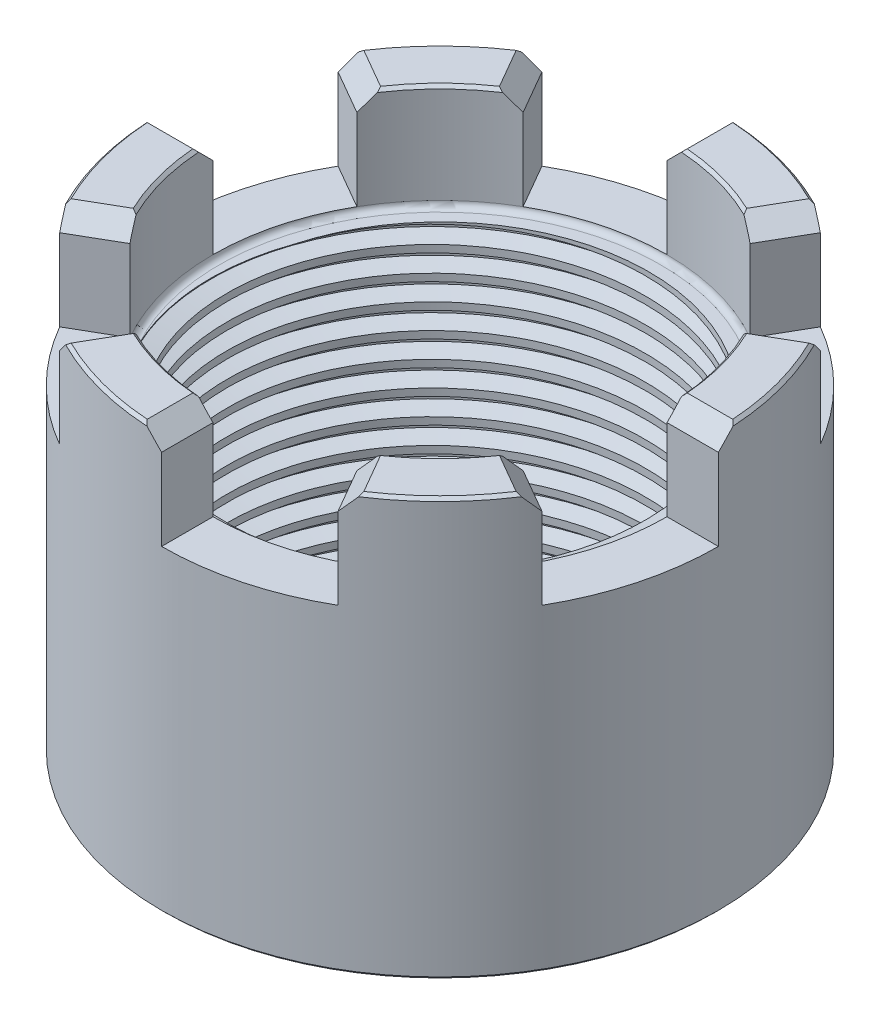
from build123d import *
from build123d.topology import SkipClean

# Parameters (mm, degrees)
SKETCH1_R           = 35.56
BOSS_EXTRUDE1_DEPTH = 40.64
SKETCH2_R           = 26.70175
CUT_EXTRUDE1_DEPTH  = 67.31
BOSS_EXTRUDE2_DEPTH = 12.7
CHAMFER1_SIZE       = 2.286
CHAMFER2_SIZE       = 2.286
CHAMFER3_SIZE       = 2.286
CHAMFER4_SIZE       = 2.286
CHAMFER5_SIZE       = 2.286
CHAMFER6_SIZE       = 2.286
CHAMFER7_SIZE       = 2.286
CHAMFER8_SIZE       = 2.286
CHAMFER9_SIZE       = 2.286
CHAMFER10_SIZE      = 2.286
CHAMFER11_SIZE      = 2.286
CHAMFER12_SIZE      = 2.286
CHAMFER13_SIZE      = 0.381
CHAMFER14_SIZE      = 0.381
CHAMFER15_SIZE      = 0.381
CHAMFER16_SIZE      = 0.381
CHAMFER17_SIZE      = 0.381
CHAMFER18_SIZE      = 0.381
CHAMFER20_SIZE      = 0.381
CHAMFER21_SIZE      = 0.381
CHAMFER22_SIZE      = 0.381
CHAMFER23_SIZE      = 0.381
CHAMFER24_SIZE      = 0.381
CHAMFER25_SIZE      = 0.381
CHAMFER26_SIZE      = 0.381
CUT_EXTRUDE2_START  = -0.762
SKETCH4_R           = 28.9941
CUT_EXTRUDE2_DEPTH  = 0.762
FILLET1_R           = 0.762
CHAMFER27_SIZE      = 2.55905
THREAD3_PITCH       = 3.175


with BuildPart() as part:
    # Sketch1 → Boss-Extrude1 (new body)
    with BuildSketch(Plane(origin=(0, 0, 0), x_dir=(1, 0, 0), z_dir=(0, 1, 0))):
        with Locations(Location((0, 0, 0), (0, 0, 270))):
            Circle(SKETCH1_R)
    extrude(amount=BOSS_EXTRUDE1_DEPTH)

    # Sketch2 → Cut-Extrude1 (cut)
    with BuildSketch(Plane(origin=(0, 40.64, 0), x_dir=(1, 0, 0), z_dir=(0, 1, 0))):
        with Locations(Location((0, 0, 0), (0, 0, 270))):
            Circle(SKETCH2_R)
    extrude(amount=-CUT_EXTRUDE1_DEPTH, mode=Mode.SUBTRACT)

    # Sketch3 → Boss-Extrude2 (add)
    with SkipClean():  # the faces are left unmerged after this step: merging them gives an invalid solid
        with BuildSketch(Plane(origin=(0, 40.64, 0), x_dir=(1, 0, 0), z_dir=(0, 1, 0))):
            with BuildLine():
                Line((-28.9941, 0), (-35.56, 0))
                ThreePointArc((-35.56, 0), (-34.348322383, -9.203605244), (-30.795863359, -17.78))
                Line((-30.795863359, -17.78), (-25.10962716, -14.49705))
                ThreePointArc((-25.10962716, -14.49705), (-28.00615, -7.504225276), (-28.9941, 0))
            make_face()
            with BuildLine():
                Line((-25.10962716, 14.49705), (-30.795863359, 17.78))
                ThreePointArc((-30.795863359, 17.78), (-25.144717139, 25.144717139), (-17.78, 30.795863359))
                Line((-17.78, 30.795863359), (-14.49705, 25.10962716))
                ThreePointArc((-14.49705, 25.10962716), (-20.501924724, 20.501924724), (-25.10962716, 14.49705))
            make_face()
            with BuildLine():
                Line((0, 28.9941), (0, 35.56))
                ThreePointArc((0, 35.56), (9.203605244, 34.348322383), (17.78, 30.795863359))
                Line((17.78, 30.795863359), (14.49705, 25.10962716))
                ThreePointArc((14.49705, 25.10962716), (7.504225276, 28.00615), (0, 28.9941))
            make_face()
            with BuildLine():
                Line((25.10962716, 14.49705), (30.795863359, 17.78))
                ThreePointArc((30.795863359, 17.78), (34.348322383, 9.203605244), (35.56, 0))
                Line((35.56, 0), (28.9941, 0))
                ThreePointArc((28.9941, 0), (28.00615, 7.504225276), (25.10962716, 14.49705))
            make_face()
            with BuildLine():
                Line((25.10962716, -14.49705), (30.795863359, -17.78))
                ThreePointArc((30.795863359, -17.78), (25.144717139, -25.144717139), (17.78, -30.795863359))
                Line((17.78, -30.795863359), (14.49705, -25.10962716))
                ThreePointArc((14.49705, -25.10962716), (20.501924724, -20.501924724), (25.10962716, -14.49705))
            make_face()
            with BuildLine():
                Line((0, -28.9941), (0, -35.56))
                ThreePointArc((0, -35.56), (-9.203605244, -34.348322383), (-17.78, -30.795863359))
                Line((-17.78, -30.795863359), (-14.49705, -25.10962716))
                ThreePointArc((-14.49705, -25.10962716), (-7.504225276, -28.00615), (0, -28.9941))
            make_face()
        extrude(amount=BOSS_EXTRUDE2_DEPTH)

    # Chamfer1
    chamfer1_edges = [part.edges().sort_by_distance(p)[0] for p in [
        (0, 53.34, 32.27705),
    ]]
    chamfer(chamfer1_edges, length=CHAMFER1_SIZE)

    # Chamfer2
    chamfer2_edges = [part.edges().sort_by_distance(p)[0] for p in [
        (-16.138525, 53.34, 27.952745259),
    ]]
    chamfer(chamfer2_edges, length=CHAMFER2_SIZE)

    # Chamfer3
    chamfer3_edges = [part.edges().sort_by_distance(p)[0] for p in [
        (-27.952745259, 53.34, 16.138525),
    ]]
    chamfer(chamfer3_edges, length=CHAMFER3_SIZE)

    # Chamfer4
    chamfer4_edges = [part.edges().sort_by_distance(p)[0] for p in [
        (16.138525, 53.34, 27.952745259),
    ]]
    chamfer(chamfer4_edges, length=CHAMFER4_SIZE)

    # Chamfer5
    chamfer5_edges = [part.edges().sort_by_distance(p)[0] for p in [
        (27.952745259, 53.34, 16.138525),
    ]]
    chamfer(chamfer5_edges, length=CHAMFER5_SIZE)

    # Chamfer6
    chamfer6_edges = [part.edges().sort_by_distance(p)[0] for p in [
        (32.27705, 53.34, 0),
    ]]
    chamfer(chamfer6_edges, length=CHAMFER6_SIZE)

    # Chamfer7
    chamfer7_edges = [part.edges().sort_by_distance(p)[0] for p in [
        (27.952745259, 53.34, -16.138525),
    ]]
    chamfer(chamfer7_edges, length=CHAMFER7_SIZE)

    # Chamfer8
    chamfer8_edges = [part.edges().sort_by_distance(p)[0] for p in [
        (16.138525, 53.34, -27.952745259),
    ]]
    chamfer(chamfer8_edges, length=CHAMFER8_SIZE)

    # Chamfer9
    chamfer9_edges = [part.edges().sort_by_distance(p)[0] for p in [
        (0, 53.34, -32.27705),
    ]]
    chamfer(chamfer9_edges, length=CHAMFER9_SIZE)

    # Chamfer10
    chamfer10_edges = [part.edges().sort_by_distance(p)[0] for p in [
        (-16.138525, 53.34, -27.952745259),
    ]]
    chamfer(chamfer10_edges, length=CHAMFER10_SIZE)

    # Chamfer11
    chamfer11_edges = [part.edges().sort_by_distance(p)[0] for p in [
        (-27.952745259, 53.34, -16.138525),
    ]]
    chamfer(chamfer11_edges, length=CHAMFER11_SIZE)

    # Chamfer12
    chamfer12_edges = [part.edges().sort_by_distance(p)[0] for p in [
        (-32.27705, 53.34, 0),
    ]]
    chamfer(chamfer12_edges, length=CHAMFER12_SIZE)

    # Chamfer13
    chamfer13_edges = [part.edges().sort_by_distance(p)[0] for p in [
        (9.203605244, 53.34, -34.348322383),
    ]]
    chamfer(chamfer13_edges, length=CHAMFER13_SIZE)

    # Chamfer14
    chamfer14_edges = [part.edges().sort_by_distance(p)[0] for p in [
        (-25.144717139, 53.34, -25.144717139),
    ]]
    chamfer(chamfer14_edges, length=CHAMFER14_SIZE)

    # Chamfer15
    chamfer15_edges = [part.edges().sort_by_distance(p)[0] for p in [
        (-34.348322383, 53.34, 9.203605244),
    ]]
    chamfer(chamfer15_edges, length=CHAMFER15_SIZE)

    # Chamfer16
    chamfer16_edges = [part.edges().sort_by_distance(p)[0] for p in [
        (-9.203605244, 53.34, 34.348322383),
    ]]
    chamfer(chamfer16_edges, length=CHAMFER16_SIZE)

    # Chamfer17
    chamfer17_edges = [part.edges().sort_by_distance(p)[0] for p in [
        (25.144717139, 53.34, 25.144717139),
    ]]
    chamfer(chamfer17_edges, length=CHAMFER17_SIZE)

    # Chamfer18
    chamfer18_edges = [part.edges().sort_by_distance(p)[0] for p in [
        (34.348322383, 53.34, -9.203605244),
    ]]
    chamfer(chamfer18_edges, length=CHAMFER18_SIZE)

    # Chamfer20
    chamfer20_edges = [part.edges().sort_by_distance(p)[0] for p in [
        (-28.00615, 53.34, 7.504225276),
    ]]
    chamfer(chamfer20_edges, length=CHAMFER20_SIZE)

    # Chamfer21
    chamfer21_edges = [part.edges().sort_by_distance(p)[0] for p in [
        (-7.504225276, 53.34, 28.00615),
    ]]
    chamfer(chamfer21_edges, length=CHAMFER21_SIZE)

    # Chamfer22
    chamfer22_edges = [part.edges().sort_by_distance(p)[0] for p in [
        (20.501924724, 53.34, 20.501924724),
    ]]
    chamfer(chamfer22_edges, length=CHAMFER22_SIZE)

    # Chamfer23
    chamfer23_edges = [part.edges().sort_by_distance(p)[0] for p in [
        (-20.501924724, 53.34, -20.501924724),
    ]]
    chamfer(chamfer23_edges, length=CHAMFER23_SIZE)

    # Chamfer24
    chamfer24_edges = [part.edges().sort_by_distance(p)[0] for p in [
        (7.504225276, 53.34, -28.00615),
    ]]
    chamfer(chamfer24_edges, length=CHAMFER24_SIZE)

    # Chamfer25
    chamfer25_edges = [part.edges().sort_by_distance(p)[0] for p in [
        (28.00615, 53.34, -7.504225276),
    ]]
    chamfer(chamfer25_edges, length=CHAMFER25_SIZE)

    # Chamfer26
    chamfer26_edges = [part.edges().sort_by_distance(p)[0] for p in [
        (0, 0, -35.56),
    ]]
    chamfer(chamfer26_edges, length=CHAMFER26_SIZE)

    # Sketch4 → Cut-Extrude2 (cut)
    with BuildSketch(Plane(origin=(0, 40.64, 0), x_dir=(1, 0, 0), z_dir=(0, 1, 0)).offset(CUT_EXTRUDE2_START)):
        with Locations(Location((0, 0, 0), (0, 0, 270))):
            Circle(SKETCH4_R)
    extrude(amount=CUT_EXTRUDE2_DEPTH, mode=Mode.SUBTRACT)

    # Fillet1
    fillet1_edges = [part.edges().sort_by_distance(p)[0] for p in [
        (0, 39.878, -28.9941),
    ]]
    fillet(fillet1_edges, radius=FILLET1_R - 0.0001)  # a hair under: the kernel refuses the full size

    # Chamfer27
    chamfer27_edges = [part.edges().sort_by_distance(p)[0] for p in [
        (0, 0, -26.70175),
    ]]
    chamfer(chamfer27_edges, length=CHAMFER27_SIZE)

    # Thread3: the profile of Thread Profile4 profile screwed along a right-hand helix of 13.6 turns, 12 arcs to a turn; built about Z, then put on its axis
    thread3_z = Axis((0, 0, 0), (0, 0, 1))
    thread3_corners = [(26.70145, 1.2e-08, -7.7585e-05), (26.70145, 1.2e-08, 2.240616333), (28.75788, 1.2e-08, 1.708787374), (28.75788, 1.2e-08, 0.531751374)]
    with BuildLine(mode=Mode.PRIVATE) as thread3_profile:
        Line(thread3_corners[0], thread3_corners[1])
        Line(thread3_corners[1], thread3_corners[2])
        Line(thread3_corners[2], thread3_corners[3])
        Line(thread3_corners[3], thread3_corners[0])
    thread3_cap = Face(thread3_profile.wire())
    thread3_turn_angles = [0, 15, 30, 45, 60, 75, 90, 105, 120, 135, 150, 165, 180, 195, 210, 225, 240, 255, 270, 285, 300, 315, 330, 345, 360]
    thread3_turn_weights = [1, 0.9659258262890683, 1, 0.9659258262890683, 1, 0.9659258262890683, 1, 0.9659258262890683, 1, 0.9659258262890683, 1, 0.9659258262890683, 1, 0.9659258262890683, 1, 0.9659258262890683, 1, 0.9659258262890683, 1, 0.9659258262890683, 1, 0.9659258262890683, 1, 0.9659258262890683, 1]
    thread3_turn_rails = [Edge.make_bspline([Vector(p[0], p[1], 0).rotate(thread3_z, thread3_turn_angles[k]) / thread3_turn_weights[k] + Vector(0, 0, p[2] + THREAD3_PITCH * thread3_turn_angles[k] / 360) for k in range(25)], [0, 0, 0, 1, 1, 2, 2, 3, 3, 4, 4, 5, 5, 6, 6, 7, 7, 8, 8, 9, 9, 10, 10, 11, 11, 12, 12, 12], 2, thread3_turn_weights) for p in thread3_corners]
    thread3_turn_sides = [Face.make_surface_from_curves(thread3_turn_rails[p[0]], thread3_turn_rails[p[1]]) for p in [(0, 1), (1, 2), (2, 3), (3, 0)]]
    thread3_last_angles = [4680, 4695, 4710, 4725, 4740, 4755, 4770, 4785, 4800, 4815, 4830, 4845, 4860, 4875, 4890, 4893, 4896]
    thread3_last_weights = [1, 0.9659258262890683, 1, 0.9659258262890683, 1, 0.9659258262890683, 1, 0.9659258262890683, 1, 0.9659258262890683, 1, 0.9659258262890683, 1, 0.9659258262890683, 1, 0.9986295347545738, 1]
    thread3_last_rails = [Edge.make_bspline([Vector(p[0], p[1], 0).rotate(thread3_z, thread3_last_angles[k]) / thread3_last_weights[k] + Vector(0, 0, p[2] + THREAD3_PITCH * thread3_last_angles[k] / 360) for k in range(17)], [0, 0, 0, 1, 1, 2, 2, 3, 3, 4, 4, 5, 5, 6, 6, 7, 7, 8, 8, 8], 2, thread3_last_weights) for p in thread3_corners]
    thread3_last_sides = [Face.make_surface_from_curves(thread3_last_rails[p[0]], thread3_last_rails[p[1]]) for p in [(0, 1), (1, 2), (2, 3), (3, 0)]]
    thread3 = Plane(origin=(0, 43.18, 0), x_dir=(-0.999847695, 0, -0.017452406), z_dir=(0, -1, 0)) * Solid(Shell([*[p.moved(Location((0, 0, THREAD3_PITCH * i))) for i in range(13) for p in thread3_turn_sides], *thread3_last_sides, thread3_cap, thread3_cap.rotate(thread3_z, 4896).moved(Location((0, 0, THREAD3_PITCH * 4896 / 360)))]))
    add(thread3, mode=Mode.SUBTRACT)


solid = part.part
